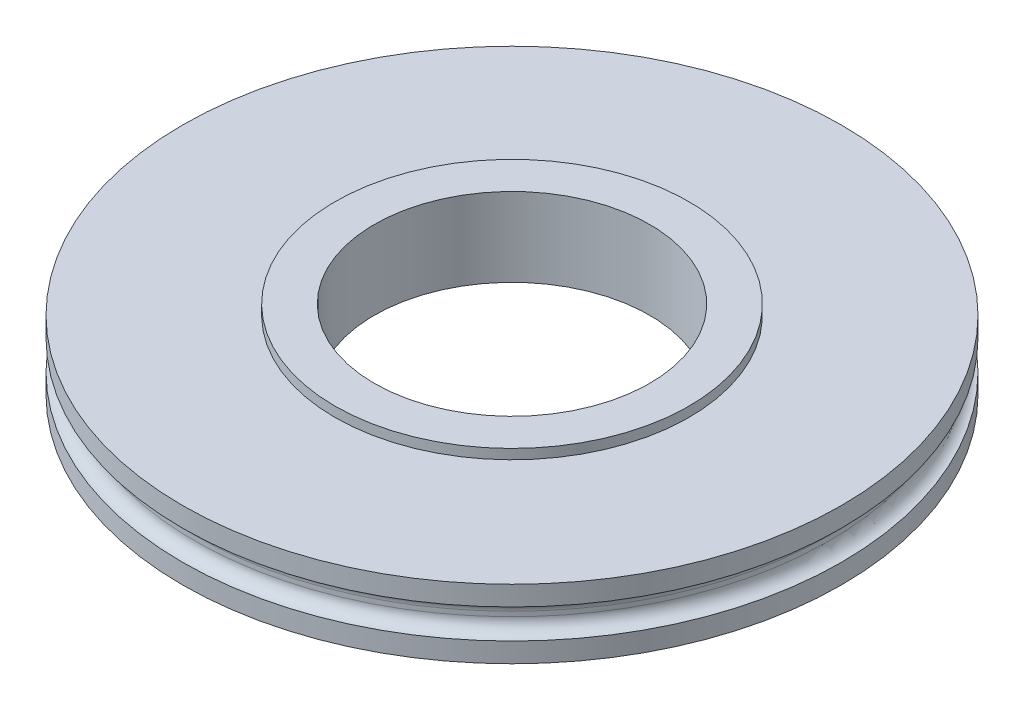
from build123d import *

# Parameters (mm, degrees)
SKETCH1_R           = 26.590625
BOSS_EXTRUDE1_DEPTH = 1.5875
SKETCH2_R           = 25.5984375
BOSS_EXTRUDE2_DEPTH = 2.38125
SKETCH3_R           = 26.590625
BOSS_EXTRUDE3_DEPTH = 1.5875
SKETCH5_R           = 14.2875
BOSS_EXTRUDE4_DEPTH = 0.79375
SKETCH6_R           = 11.1125
CUT_EXTRUDE1_DEPTH  = 39.137188881
FILLET1_R           = 1
FILLET2_R           = 1


with BuildPart() as part:
    # Sketch1 → Boss-Extrude1 (new body)
    with BuildSketch(Plane(origin=(0, 0, 0), x_dir=(1, 0, 0), z_dir=(0, 1, 0))):
        with Locations(Location((0, 0, 0), (0, 0, 270))):
            Circle(SKETCH1_R)
    extrude(amount=BOSS_EXTRUDE1_DEPTH)

    # Sketch2 → Boss-Extrude2 (add)
    with BuildSketch(Plane(origin=(0, 1.5875, 0), x_dir=(1, 0, 0), z_dir=(0, 1, 0))):
        with Locations(Location((0, 0, 0), (0, 0, 90))):
            Circle(SKETCH2_R)
    extrude(amount=BOSS_EXTRUDE2_DEPTH)

    # Sketch3 → Boss-Extrude3 (add)
    with BuildSketch(Plane(origin=(0, 3.96875, 0), x_dir=(1, 0, 0), z_dir=(0, 1, 0))):
        with Locations(Location((0, 0, 0), (0, 0, 270))):
            Circle(SKETCH3_R)
    extrude(amount=BOSS_EXTRUDE3_DEPTH)

    # Sketch5 → Boss-Extrude4 (add)
    with BuildSketch(Plane(origin=(0, 5.55625, 0), x_dir=(1, 0, 0), z_dir=(0, 1, 0))):
        with Locations(Location((0, 0, 0), (0, 0, 270))):
            Circle(SKETCH5_R)
    extrude(amount=BOSS_EXTRUDE4_DEPTH)

    # Sketch6 → Cut-Extrude1 (cut, through all)
    with BuildSketch(Plane(origin=(0, 6.35, 0), x_dir=(1, 0, 0), z_dir=(0, 1, 0))):
        with Locations(Location((0, 0, 0), (0, 0, 270))):
            Circle(SKETCH6_R)
    extrude(amount=-CUT_EXTRUDE1_DEPTH, mode=Mode.SUBTRACT)

    # Fillet1
    # the kernel refuses this fillet: 1 mm, written as the material it adds along each edge
    with BuildSketch(Plane(origin=(0, 1.5875, 0), x_dir=(0, 0, -1), z_dir=(1, 0, 0))) as fillet1_piece_1_section:
        with BuildLine():
            CenterArc((25.5984375 + FILLET1_R, FILLET1_R), FILLET1_R, 180, 90)
            Line((25.5984375 + FILLET1_R, 0), (25.5984375, 0))
            Line((25.5984375, 0), (25.5984375, FILLET1_R))
        make_face()
    fillet1_piece_1 = revolve(axis=Axis((0, 1.5875, 0), (0, 1, 0)), mode=Mode.PRIVATE)
    fillet1_piece_1 = fillet1_piece_1 & Plane(origin=(0, 1.858804506, 0), x_dir=(0, 0, 1), z_dir=(0, -1, 0)) * Cylinder(26.590625, 107, mode=Mode.PRIVATE)
    add(fillet1_piece_1)

    # Fillet2
    # the kernel refuses this fillet: 1 mm, written as the material it adds along each edge
    with BuildSketch(Plane(origin=(0, 3.96875, 0), x_dir=(0, 0, -1), z_dir=(1, 0, 0))) as fillet2_piece_1_section:
        with BuildLine():
            CenterArc((25.5984375 + FILLET2_R, -FILLET2_R), FILLET2_R, 90, 90)
            Line((25.5984375 + FILLET2_R, 0), (25.5984375, 0))
            Line((25.5984375, 0), (25.5984375, -FILLET2_R))
        make_face()
    fillet2_piece_1 = revolve(axis=Axis((0, 3.96875, 0), (0, 1, 0)), mode=Mode.PRIVATE)
    fillet2_piece_1 = fillet2_piece_1 & Plane(origin=(0, 3.697445494, 0), x_dir=(0, 0, 1), z_dir=(0, -1, 0)) * Cylinder(26.590625, 107, mode=Mode.PRIVATE)
    add(fillet2_piece_1)


solid = part.part
